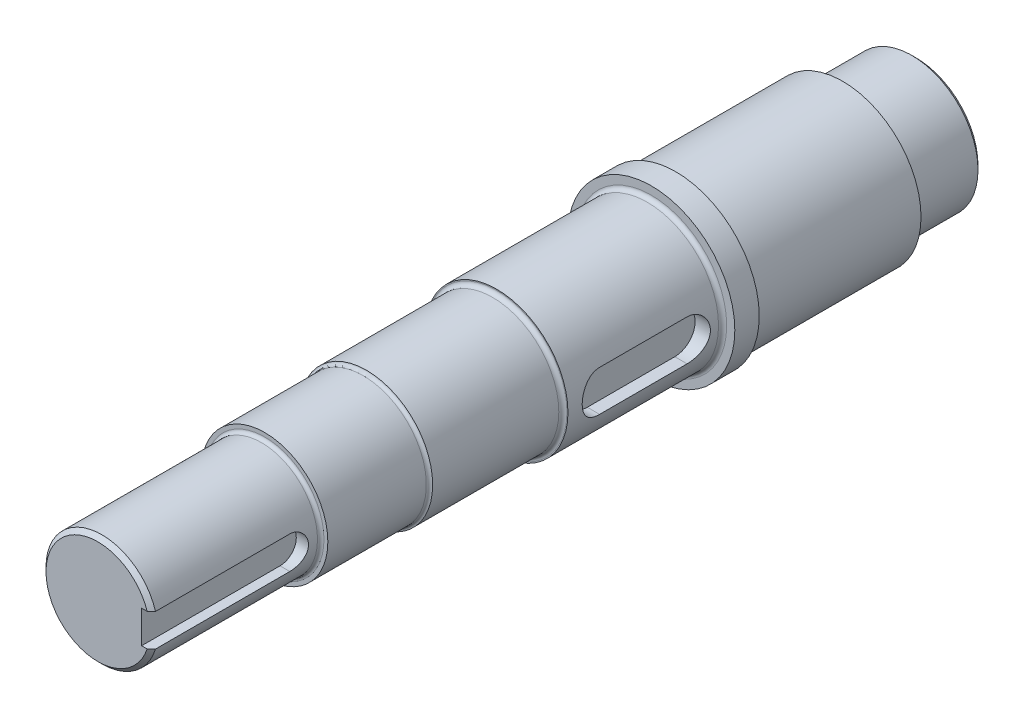
from build123d import *

# Parameters (mm, degrees)
SKETCH_1_R          = 32.5
EXTRUDE_1_DEPTH     = 36
SKETCH_2_R          = 38.5
EXTRUDE_2_DEPTH     = 82
SKETCH_3_R          = 41
EXTRUDE_3_DEPTH     = 12
SKETCH_4_R          = 35
EXTRUDE_4_DEPTH     = 76
SKETCH_5_R          = 32.5
EXTRUDE_5_DEPTH     = 64
SKETCH_6_R          = 31
EXTRUDE_6_DEPTH     = 50
SKETCH_7_R          = 27.5
EXTRUDE_7_DEPTH     = 82
FILLET_1_R          = 2
FILLET_2_R          = 1.6
CHAMFER_1_SIZE      = 2
CUT_EXTRUDE_1_DEPTH = 29
CUT_EXTRUDE_2_DEPTH = 20


with BuildPart() as part:
    # 草图1 → 凸台-拉伸1 (new body)
    with BuildSketch(Plane.XY):
        Circle(SKETCH_1_R)
    extrude(amount=EXTRUDE_1_DEPTH)

    # 草图2 → 凸台-拉伸2 (add)
    with BuildSketch(Plane.XY.offset(36)):
        Circle(SKETCH_2_R)
    extrude(amount=EXTRUDE_2_DEPTH)

    # 草图3 → 凸台-拉伸3 (add)
    with BuildSketch(Plane.XY.offset(118)):
        Circle(SKETCH_3_R)
    extrude(amount=EXTRUDE_3_DEPTH)

    # 草图4 → 凸台-拉伸4 (add)
    with BuildSketch(Plane.XY.offset(130)):
        Circle(SKETCH_4_R)
    extrude(amount=EXTRUDE_4_DEPTH)

    # 草图5 → 凸台-拉伸5 (add)
    with BuildSketch(Plane.XY.offset(206)):
        Circle(SKETCH_5_R)
    extrude(amount=EXTRUDE_5_DEPTH)

    # 草图6 → 凸台-拉伸6 (add)
    with BuildSketch(Plane.XY.offset(270)):
        Circle(SKETCH_6_R)
    extrude(amount=EXTRUDE_6_DEPTH)

    # 草图7 → 凸台-拉伸7 (add)
    with BuildSketch(Plane.XY.offset(320)):
        Circle(SKETCH_7_R)
    extrude(amount=EXTRUDE_7_DEPTH)

    # 圆角1
    fillet_1_edges = [part.edges().sort_by_distance(p)[0] for p in [
        (-35, 0, 130),
        (-32.5, 0, 206),
    ]]
    fillet(fillet_1_edges, radius=FILLET_1_R)

    # 圆角2
    # the kernel refuses this fillet: 1.6 mm, written as the material it adds along each edge
    with BuildSketch(Plane(origin=(0, 0, 270), x_dir=(1, 0, 0), z_dir=(0, -1, 0))) as fillet_2_piece_1:
        with BuildLine():
            CenterArc((32.6, 1.596871942), FILLET_2_R, 180, 86.416678302)
            Line((31, 1.596871942), (30.968, 1.596871942))
            Line((30.968, 1.596871942), (30.968, 0))
            Line((30.968, 0), (31, -0.032))
            ThreePointArc((31, -0.032), (31.75, -0.032), (32.498, -0.031937439))
            Line((32.498, -0.031937439), (32.5, 0))
        make_face()
    revolve(axis=Axis((0, 0, 270), (0, 0, 1)))
    with BuildSketch(Plane(origin=(0, 0, 320), x_dir=(1, 0, 0), z_dir=(0, -1, 0))) as fillet_2_piece_2:
        with BuildLine():
            CenterArc((27.5 + FILLET_2_R, FILLET_2_R), FILLET_2_R, 180, 90)
            Line((27.5, FILLET_2_R), (27.5 - FILLET_2_R * 0.02, FILLET_2_R))
            Line((27.5 - FILLET_2_R * 0.02, FILLET_2_R), (27.5 - FILLET_2_R * 0.02, -FILLET_2_R * 0.02))
            Line((27.5 - FILLET_2_R * 0.02, -FILLET_2_R * 0.02), (27.5 + FILLET_2_R, -FILLET_2_R * 0.02))
            Line((27.5 + FILLET_2_R, -FILLET_2_R * 0.02), (27.5 + FILLET_2_R, 0))
        make_face()
    revolve(axis=Axis((0, 0, 320), (0, 0, 1)))

    # 倒角1
    chamfer_1_edges = [part.edges().sort_by_distance(p)[0] for p in [
        (-32.5, 0, 0),
        (-27.5, 0, 402),
    ]]
    chamfer(chamfer_1_edges, length=CHAMFER_1_SIZE)

    # 草图8 → 切除-拉伸1 (cut)
    with BuildSketch(Plane(origin=(27.5, 0, 0), x_dir=(0, 0, -1), z_dir=(1, 0, 0))):
        with BuildLine():
            Line((-189, 10), (-146, 10))
            ThreePointArc((-146, 10), (-136, 0), (-146, -10))
            Line((-146, -10), (-189, -10))
            ThreePointArc((-189, -10), (-199, 0), (-189, 10))
        make_face()
    extrude(amount=CUT_EXTRUDE_1_DEPTH, mode=Mode.SUBTRACT)

    # 草图9 → 切除-拉伸2 (cut)
    with BuildSketch(Plane(origin=(21.5, 0, 0), x_dir=(0, 0, -1), z_dir=(1, 0, 0))):
        with BuildLine():
            Line((-402, 8), (-334, 8))
            ThreePointArc((-334, 8), (-326, 0), (-334, -8))
            Line((-334, -8), (-402, -8))
            Line((-402, -8), (-402, 8))
        make_face()
    extrude(amount=CUT_EXTRUDE_2_DEPTH, mode=Mode.SUBTRACT)


solid = part.part
